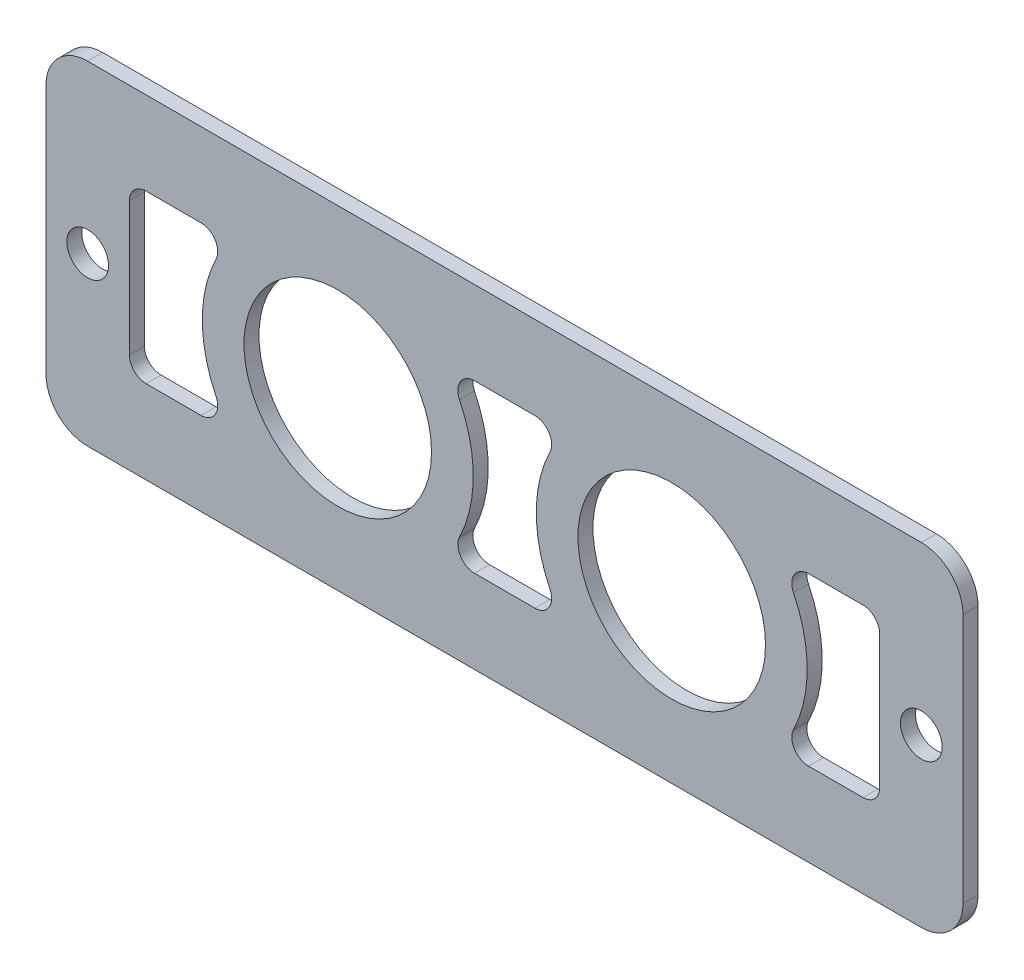
from build123d import *

# Parameters (mm, degrees)
SKETCH1_W           = 139.7
SKETCH1_H           = 50.8
SKETCH1_R           = 3.175
SKETCH1_R_2         = 14.2875
BOSS_EXTRUDE1_DEPTH = 1.143
FILLET1_R           = 6.35
CUT_EXTRUDE1_DEPTH  = 2.54
FILLET2_R           = 2.54


with BuildPart() as part:
    # Sketch1 → Boss-Extrude1 (new, symmetric)
    with BuildSketch(Plane.XY):
        Rectangle(SKETCH1_W, SKETCH1_H)
        with Locations((-63.5, 0)):
            Circle(SKETCH1_R, mode=Mode.SUBTRACT)
        with Locations((63.5, 0)):
            Circle(SKETCH1_R, mode=Mode.SUBTRACT)
        with Locations((-25.4, 0)):
            Circle(SKETCH1_R_2, mode=Mode.SUBTRACT)
        with Locations((25.4762, 0)):
            Circle(SKETCH1_R_2, mode=Mode.SUBTRACT)
    extrude(amount=BOSS_EXTRUDE1_DEPTH, both=True)

    # Fillet1
    fillet1_edges = [part.edges().sort_by_distance(p)[0] for p in [
        (69.85, -25.4, 0),
        (-69.85, -25.4, 0),
        (-69.85, 25.4, 0),
        (69.85, 25.4, 0),
    ]]
    fillet(fillet1_edges, radius=FILLET1_R)

    # Sketch2 → Cut-Extrude1 (cut)
    with BuildSketch(Plane.XY.offset(1.143)):
        with BuildLine():
            Line((-57.15, 12.7), (-57.15, -12.7))
            Line((-57.15, -12.7), (-41.667034341, -12.7))
            ThreePointArc((-41.667034341, -12.7), (-46.0375, 0), (-41.667034341, 12.7))
            Line((-41.667034341, 12.7), (-57.15, 12.7))
        make_face()
        with BuildLine():
            ThreePointArc((-9.132965659, 12.7), (-4.7625, 0), (-9.132965659, -12.7))
            Line((-9.132965659, -12.7), (9.209165659, -12.7))
            ThreePointArc((9.209165659, -12.7), (4.8387, 0), (9.209165659, 12.7))
            Line((9.209165659, 12.7), (-9.132965659, 12.7))
        make_face()
        with BuildLine():
            ThreePointArc((41.743234341, 12.7), (46.1137, 0), (41.743234341, -12.7))
            Line((41.743234341, -12.7), (57.15, -12.7))
            Line((57.15, -12.7), (57.15, 12.7))
            Line((57.15, 12.7), (41.743234341, 12.7))
        make_face()
    extrude(amount=-CUT_EXTRUDE1_DEPTH, mode=Mode.SUBTRACT)

    # Fillet2
    fillet2_edges = [part.edges().sort_by_distance(p)[0] for p in [
        (41.743234341, 12.7, 0),
        (57.15, 12.7, 0),
        (57.15, -12.7, 0),
        (-41.667034341, -12.7, 0),
        (-57.15, -12.7, 0),
        (-57.15, 12.7, 0),
        (-41.667034341, 12.7, 0),
        (9.209165659, -12.7, 0),
        (-9.132965659, 12.7, 0),
        (9.209165659, 12.7, 0),
        (41.743234341, -12.7, 0),
        (-9.132965659, -12.7, 0),
    ]]
    fillet(fillet2_edges, radius=FILLET2_R)


solid = part.part
